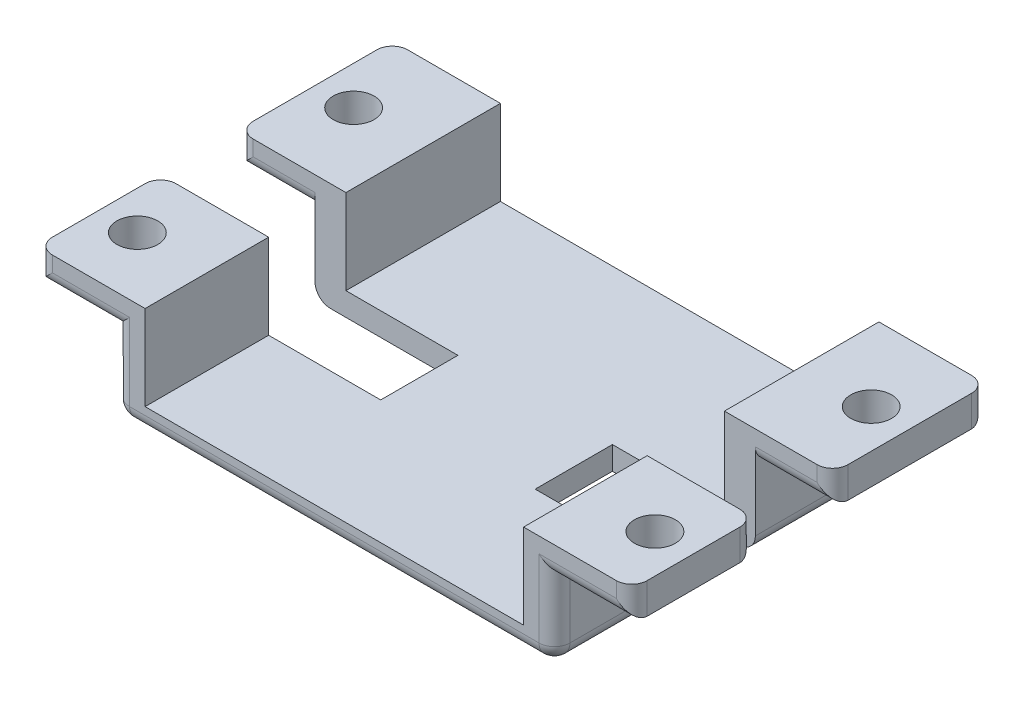
from build123d import *

# Parameters (mm, degrees)
SKETCH1_W           = 28.5
SKETCH1_H           = 36
SKETCH1_W_2         = 24.5
SKETCH1_H_2         = 33
BOSS_EXTRUDE1_DEPTH = 10
SKETCH2_W           = 5
SKETCH2_H           = 4
BOSS_EXTRUDE2_DEPTH = 10
SKETCH3_R           = 1.325
CUT_EXTRUDE1_DEPTH  = 10
FILLET1_R           = 1
FILLET2_R           = 1
CUT_EXTRUDE2_DEPTH  = 40.322385482
SKETCH5_W           = 15
SKETCH5_H           = 1.5
SKETCH5_W_2         = 2
SKETCH5_H_2         = 10
BOSS_EXTRUDE3_DEPTH = 5
SKETCH6_W           = 10
SKETCH6_H           = 1.5
BOSS_EXTRUDE4_DEPTH = 5
BOSS_EXTRUDE5_DEPTH = 8
SKETCH8_W           = 7
SKETCH8_H           = 3
CUT_EXTRUDE3_DEPTH  = 5
SKETCH9_W           = 5
SKETCH9_H           = 2.1
CUT_EXTRUDE4_DEPTH  = 5
SKETCH10_W          = 10
SKETCH10_H          = 1.5
BOSS_EXTRUDE6_DEPTH = 8
SKETCH11_W          = 5
SKETCH11_H          = 4
BOSS_EXTRUDE7_DEPTH = 8
SKETCH12_R          = 1.325
CUT_EXTRUDE5_DEPTH  = 42.37405588
CUT_EXTRUDE6_DEPTH  = 46.072164359
FILLET3_R           = 1


with BuildPart() as part:
    # Sketch1 → Boss-Extrude1 (new body)
    with BuildSketch(Plane.XY):
        Rectangle(SKETCH1_W, SKETCH1_H)
        Rectangle(SKETCH1_W_2, SKETCH1_H_2, mode=Mode.SUBTRACT)
    extrude(amount=BOSS_EXTRUDE1_DEPTH)

    # Sketch2 → Boss-Extrude2 (add)
    with BuildSketch(Plane.XY.offset(10)):
        with Locations((-16.75, -11)):
            Rectangle(SKETCH2_W, SKETCH2_H)
        with Locations((16.75, -11)):
            Rectangle(SKETCH2_W, SKETCH2_H)
    extrude(amount=-BOSS_EXTRUDE2_DEPTH)

    # Sketch3 → Cut-Extrude1 (cut)
    with BuildSketch(Plane(origin=(0, -9, 0), x_dir=(1, 0, 0), z_dir=(0, 1, 0))):
        with Locations(Location((-16.75, -5, 0), (0, 0, 270))):
            Circle(SKETCH3_R)
        with Locations(Location((16.75, -5, 0), (0, 0, 270))):
            Circle(SKETCH3_R)
    extrude(amount=-CUT_EXTRUDE1_DEPTH, mode=Mode.SUBTRACT)


with BuildPart() as body_2:
    # Split1: the piece on the far side of the plane
    add(part.part)
    split(bisect_by=Plane(origin=(0, -11, 0), x_dir=(0, 0, -1), z_dir=(0, -1, 0)), keep=Keep.BOTTOM)

    # Fillet1
    fillet1_edges = [body_2.edges().sort_by_distance(p)[0] for p in [
        (-16.75, -9, 10),
        (-19.25, -10, 10),
        (-19.25, -10, 0),
        (-16.75, -9, 0),
        (14.25, 4.5, 0),
        (0, 18, 0),
        (-14.25, 4.5, 0),
        (16.75, -9, 0),
        (19.25, -10, 10),
        (19.25, -10, 0),
        (16.75, -9, 10),
    ]]
    fillet(fillet1_edges, radius=FILLET1_R)

    # Sketch4 → Cut-Extrude2 (cut, through all)
    with BuildSketch(Plane.ZY.offset(14.25)):
        with BuildLine():
            Line((7, 12.5), (7, -3.5))
            ThreePointArc((7, -3.5), (5, -5.5), (3, -3.5))
            Line((3, -3.5), (3, 12.5))
            ThreePointArc((3, 12.5), (5, 14.5), (7, 12.5))
        make_face()
    extrude(amount=-CUT_EXTRUDE2_DEPTH, mode=Mode.SUBTRACT)

    # Sketch5 → Boss-Extrude3 (add)
    with BuildSketch(Plane.XY.offset(10)):
        with Locations((0, 17.25)):
            Rectangle(SKETCH5_W, SKETCH5_H)
        with Locations((-13.25, 4)):
            Rectangle(SKETCH5_W_2, SKETCH5_H_2)
        with Locations((13.25, 4)):
            Rectangle(SKETCH5_W_2, SKETCH5_H_2)
    extrude(amount=BOSS_EXTRUDE3_DEPTH)



with BuildPart() as part_1:
    add(part.part)

    # Split1
    split(bisect_by=Plane(origin=(0, -11, 0), x_dir=(0, 0, -1), z_dir=(0, -1, 0)), keep=Keep.TOP)

    # Fillet2
    fillet2_edges = [part_1.edges().sort_by_distance(p)[0] for p in [
        (-14.25, -15.5, 0),
        (-16.75, -13, 0),
        (-19.25, -12, 10),
        (-16.75, -13, 10),
        (-19.25, -12, 0),
        (16.75, -13, 10),
        (19.25, -12, 10),
        (19.25, -12, 0),
        (16.75, -13, 0),
        (0, -18, 0),
        (14.25, -15.5, 0),
    ]]
    fillet(fillet2_edges, radius=FILLET2_R)

    # Sketch6 → Boss-Extrude4 (add)
    with BuildSketch(Plane.XY.offset(10)):
        with Locations((0, -17.25)):
            Rectangle(SKETCH6_W, SKETCH6_H)
    extrude(amount=BOSS_EXTRUDE4_DEPTH)


with BuildPart() as body_2_1:
    add(body_2.part)

    add(part_1.part)  # Boss-Extrude5 merges part
    # Sketch7 → Boss-Extrude5 (add)
    with BuildSketch(Plane.XY.offset(15)):
        Polygon((14.25, 9), (14.25, 18), (14.25, 19.5), (-14.25, 19.5), (-14.25, 18), (-14.25, 9), (-14.25, -1), (-14.25, -10), (-14.25, -11), (-12.25, -11), (-12.25, -1), (-12.25, 9), (-12.25, 16.5), (-7.5, 16.5), (7.5, 16.5), (12.25, 16.5), (12.25, 9), (12.25, -1), (12.25, -11), (14.25, -11), (14.25, -10), (14.25, -1), align=None)
    extrude(amount=BOSS_EXTRUDE5_DEPTH)

    # Sketch8 → Cut-Extrude3 (cut)
    with BuildSketch(Plane.XY.offset(23)):
        with Locations((0, 16.5)):
            Rectangle(SKETCH8_W, SKETCH8_H)
    extrude(amount=-CUT_EXTRUDE3_DEPTH, mode=Mode.SUBTRACT)

    # Sketch9 → Cut-Extrude4 (cut)
    with BuildSketch(Plane.XY.offset(23)):
        with Locations((6, 17.55)):
            Rectangle(SKETCH9_W, SKETCH9_H)
        with Locations((-6, 17.55)):
            Rectangle(SKETCH9_W, SKETCH9_H)
    extrude(amount=-CUT_EXTRUDE4_DEPTH, mode=Mode.SUBTRACT)

    # Sketch10 → Boss-Extrude6 (add)
    with BuildSketch(Plane.XY.offset(15)):
        Polygon((-5, -18), (-5, -16.5), (-12.25, -16.5), (-12.25, -11), (-14.25, -11), (-14.25, -12), (-14.25, -18), align=None)
        with Locations((0, -17.25)):
            Rectangle(SKETCH10_W, SKETCH10_H)
        Polygon((12.25, -11), (12.25, -16.5), (5, -16.5), (5, -18), (14.25, -18), (14.25, -12), (14.25, -11), align=None)
    extrude(amount=BOSS_EXTRUDE6_DEPTH)

    # Sketch11 → Boss-Extrude7 (add)
    with BuildSketch(Plane.XY.offset(23)):
        with Locations((-16.75, -11)):
            Rectangle(SKETCH11_W, SKETCH11_H)
        with Locations((16.75, -11)):
            Rectangle(SKETCH11_W, SKETCH11_H)
    extrude(amount=-BOSS_EXTRUDE7_DEPTH)

    # Sketch12 → Cut-Extrude5 (cut, through all)
    with BuildSketch(Plane(origin=(0, -9, 0), x_dir=(1, 0, 0), z_dir=(0, 1, 0))):
        with Locations(Location((-16.75, -19, 0), (0, 0, 270))):
            Circle(SKETCH12_R)
        with Locations(Location((16.75, -19, 0), (0, 0, 270))):
            Circle(SKETCH12_R)
    extrude(amount=-CUT_EXTRUDE5_DEPTH, mode=Mode.SUBTRACT)

    # Sketch13 → Cut-Extrude6 (cut, through all)
    with BuildSketch(Plane.ZY.offset(14.25)):
        with BuildLine():
            Line((17, -3.5), (17, 12.5))
            ThreePointArc((17, 12.5), (19, 14.5), (21, 12.5))
            Line((21, 12.5), (21, -3.5))
            ThreePointArc((21, -3.5), (19, -5.5), (17, -3.5))
        make_face()
    extrude(amount=-CUT_EXTRUDE6_DEPTH, mode=Mode.SUBTRACT)

    # Fillet3
    # the kernel refuses this fillet: 1 mm, written as the material it takes off along each edge
    with BuildSketch(Plane(origin=(13.25, -17, 1), x_dir=(1, 0, 0), z_dir=(0, -1, 0))) as fillet3_piece_1_section:
        Polygon((0, 0), (FILLET3_R, 0), (FILLET3_R, -FILLET3_R), (0, -FILLET3_R), align=None)
    fillet3_piece_1 = extrude(amount=FILLET3_R, mode=Mode.PRIVATE)
    fillet3_piece_1 = fillet3_piece_1 - Plane(origin=(13.25, -17, 1), x_dir=(-0.7071067811865475, 0, 0.7071067811865475), z_dir=(0, -1, 0)) * Sphere(FILLET3_R, mode=Mode.PRIVATE)
    add(fillet3_piece_1, mode=Mode.SUBTRACT)
    with BuildSketch(Plane(origin=(-13.25, -17, 1), x_dir=(-1, 0, 0), z_dir=(0, -1, 0))) as fillet3_piece_2_section:
        Polygon((0, 0), (FILLET3_R, 0), (FILLET3_R, FILLET3_R), (0, FILLET3_R), align=None)
    fillet3_piece_2 = extrude(amount=FILLET3_R, mode=Mode.PRIVATE)
    fillet3_piece_2 = fillet3_piece_2 - Plane(origin=(-13.25, -17, 1), x_dir=(0.7071067811865475, 0, 0.7071067811865475), z_dir=(0, -1, 0)) * Sphere(FILLET3_R, mode=Mode.PRIVATE)
    add(fillet3_piece_2, mode=Mode.SUBTRACT)
    with BuildSketch(Plane(origin=(13.25, 17, 1), x_dir=(0, 1, 0), z_dir=(1, 0, 0))) as fillet3_piece_3_section:
        Polygon((0, 0), (FILLET3_R, 0), (FILLET3_R, -FILLET3_R), (0, -FILLET3_R), align=None)
    fillet3_piece_3 = extrude(amount=FILLET3_R, mode=Mode.PRIVATE)
    fillet3_piece_3 = fillet3_piece_3 - Plane(origin=(13.25, 17, 1), x_dir=(0, -0.7071067811865475, 0.7071067811865475), z_dir=(1, 0, 0)) * Sphere(FILLET3_R, mode=Mode.PRIVATE)
    add(fillet3_piece_3, mode=Mode.SUBTRACT)
    with BuildSketch(Plane(origin=(-13.25, 17, 1), x_dir=(0, 1, 0), z_dir=(-1, 0, 0))) as fillet3_piece_4_section:
        Polygon((0, 0), (FILLET3_R, 0), (FILLET3_R, FILLET3_R), (0, FILLET3_R), align=None)
    fillet3_piece_4 = extrude(amount=FILLET3_R, mode=Mode.PRIVATE)
    fillet3_piece_4 = fillet3_piece_4 - Plane(origin=(-13.25, 17, 1), x_dir=(0, -0.7071067811865475, 0.7071067811865475), z_dir=(-1, 0, 0)) * Sphere(FILLET3_R, mode=Mode.PRIVATE)
    add(fillet3_piece_4, mode=Mode.SUBTRACT)
    with BuildSketch(Plane(origin=(13.25, -17, 22), x_dir=(0, 0, 1), z_dir=(0, -1, 0))) as fillet3_piece_5_section:
        Polygon((0, 0), (FILLET3_R, 0), (FILLET3_R, -FILLET3_R), (0, -FILLET3_R), align=None)
    fillet3_piece_5 = extrude(amount=FILLET3_R, mode=Mode.PRIVATE)
    fillet3_piece_5 = fillet3_piece_5 - Plane(origin=(13.25, -17, 22), x_dir=(-0.7071067811865475, 0, -0.7071067811865475), z_dir=(0, -1, 0)) * Sphere(FILLET3_R, mode=Mode.PRIVATE)
    add(fillet3_piece_5, mode=Mode.SUBTRACT)
    with BuildSketch(Plane(origin=(-13.25, -17, 22), x_dir=(-1, 0, 0), z_dir=(0, -1, 0))) as fillet3_piece_6_section:
        Polygon((0, 0), (FILLET3_R, 0), (FILLET3_R, -FILLET3_R), (0, -FILLET3_R), align=None)
    fillet3_piece_6 = extrude(amount=FILLET3_R, mode=Mode.PRIVATE)
    fillet3_piece_6 = fillet3_piece_6 - Plane(origin=(-13.25, -17, 22), x_dir=(0.7071067811865475, 0, -0.7071067811865475), z_dir=(0, -1, 0)) * Sphere(FILLET3_R, mode=Mode.PRIVATE)
    add(fillet3_piece_6, mode=Mode.SUBTRACT)
    with BuildSketch(Plane(origin=(-14.25, 18, 1), x_dir=(0, -1, 0), z_dir=(0, 0, 1)), Plane(origin=(-14.25, -18, 1), x_dir=(1, 0, 0), z_dir=(0, 0, 1))) as fillet3_piece_7:
        with BuildLine():
            CenterArc((FILLET3_R, FILLET3_R), FILLET3_R, 180, 90)
            Line((0, FILLET3_R), (0, 0))
            Line((0, 0), (FILLET3_R, 0))
        make_face()
    extrude(amount=11.5, mode=Mode.SUBTRACT)
    with BuildSketch(Plane(origin=(14.25, 18, 1), x_dir=(0, -1, 0), z_dir=(0, 0, 1)), Plane(origin=(14.25, -18, 1), x_dir=(-1, 0, 0), z_dir=(0, 0, 1))) as fillet3_piece_8:
        with BuildLine():
            CenterArc((FILLET3_R, -FILLET3_R), FILLET3_R, 90, 90)
            Line((0, -FILLET3_R), (0, 0))
            Line((0, 0), (FILLET3_R, 0))
        make_face()
    extrude(amount=11.5, mode=Mode.SUBTRACT)
    with BuildSketch(Plane(origin=(14.25, 19.5, 12.5), x_dir=(0, -1, 0), z_dir=(0, 0, 1))) as fillet3_piece_9:
        with BuildLine():
            CenterArc((FILLET3_R, -FILLET3_R), FILLET3_R, 90, 90)
            Line((0, -FILLET3_R), (0, 0))
            Line((0, 0), (FILLET3_R, 0))
        make_face()
    extrude(amount=13, mode=Mode.SUBTRACT)
    with BuildSketch(Plane(origin=(-14.25, 19.5, 12.5), x_dir=(0, -1, 0), z_dir=(0, 0, 1))) as fillet3_piece_10:
        with BuildLine():
            CenterArc((FILLET3_R, FILLET3_R), FILLET3_R, 180, 90)
            Line((0, FILLET3_R), (0, 0))
            Line((0, 0), (FILLET3_R, 0))
        make_face()
    extrude(amount=13, mode=Mode.SUBTRACT)
    with BuildSketch(Plane(origin=(14.25, -17, 23), x_dir=(-1, 0, 0), z_dir=(0, 1, 0)), Plane(origin=(-14.25, -17, 23), x_dir=(0, 0, -1), z_dir=(0, 1, 0))) as fillet3_piece_11:
        with BuildLine():
            CenterArc((FILLET3_R, -FILLET3_R), FILLET3_R, 90, 90)
            Line((0, -FILLET3_R), (0, 0))
            Line((0, 0), (FILLET3_R, 0))
        make_face()
    extrude(amount=4, mode=Mode.SUBTRACT)
    with BuildSketch(Plane(origin=(-14.25, -9, 23), x_dir=(1, 0, 0), z_dir=(0, 1, 0))) as fillet3_piece_12:
        with BuildLine():
            CenterArc((FILLET3_R, FILLET3_R), FILLET3_R, 180, 90)
            Line((0, FILLET3_R), (0, 0))
            Line((0, 0), (FILLET3_R, 0))
        make_face()
    extrude(amount=31, mode=Mode.SUBTRACT)
    with BuildSketch(Plane(origin=(-13.25, -18, 23), x_dir=(0, 0, -1), z_dir=(1, 0, 0))) as fillet3_piece_13:
        with BuildLine():
            CenterArc((FILLET3_R, FILLET3_R), FILLET3_R, 180, 90)
            Line((0, FILLET3_R), (0, 0))
            Line((0, 0), (FILLET3_R, 0))
        make_face()
    extrude(amount=26.5, mode=Mode.SUBTRACT)
    with BuildSketch(Plane(origin=(-14.25, -18, 12.5), x_dir=(1, 0, 0), z_dir=(0, 0, 1))) as fillet3_piece_14:
        with BuildLine():
            CenterArc((FILLET3_R, FILLET3_R), FILLET3_R, 180, 90)
            Line((0, FILLET3_R), (0, 0))
            Line((0, 0), (FILLET3_R, 0))
        make_face()
    extrude(amount=9.5, mode=Mode.SUBTRACT)
    with BuildSketch(Plane(origin=(14.25, -18, 12.5), x_dir=(-1, 0, 0), z_dir=(0, 0, 1))) as fillet3_piece_15:
        with BuildLine():
            CenterArc((FILLET3_R, -FILLET3_R), FILLET3_R, 90, 90)
            Line((0, -FILLET3_R), (0, 0))
            Line((0, 0), (FILLET3_R, 0))
        make_face()
    extrude(amount=9.5, mode=Mode.SUBTRACT)
    with BuildSketch(Plane(origin=(-21.75, -9, 23), x_dir=(0, -1, 0), z_dir=(1, 0, 0)), Plane(origin=(-14.25, -13, 23), x_dir=(0, 1, 0), z_dir=(-1, 0, 0)), Plane(origin=(14.25, -9, 23), x_dir=(0, -1, 0), z_dir=(1, 0, 0)), Plane(origin=(21.75, -13, 23), x_dir=(0, 1, 0), z_dir=(-1, 0, 0))) as fillet3_piece_16:
        with BuildLine():
            CenterArc((FILLET3_R, FILLET3_R), FILLET3_R, 180, 90)
            Line((0, FILLET3_R), (0, 0))
            Line((0, 0), (FILLET3_R, 0))
        make_face()
    extrude(amount=7.5, mode=Mode.SUBTRACT)
    with BuildSketch(Plane(origin=(-19.25, -15.5, 23), x_dir=(1, 0, 0), z_dir=(0, 1, 0)), Plane(origin=(19.25, -6.5, 23), x_dir=(-1, 0, 0), z_dir=(0, -1, 0))) as fillet3_piece_17:
        with BuildLine():
            CenterArc((FILLET3_R, FILLET3_R), FILLET3_R, 180, 90)
            Line((0, FILLET3_R), (0, 0))
            Line((0, 0), (FILLET3_R, 0))
        make_face()
    extrude(amount=9, mode=Mode.SUBTRACT)
    with BuildSketch(Plane(origin=(-21.75, -9, 15), x_dir=(0, -1, 0), z_dir=(1, 0, 0)), Plane(origin=(-14.25, -13, 15), x_dir=(0, 1, 0), z_dir=(-1, 0, 0)), Plane(origin=(14.25, -9, 15), x_dir=(0, -1, 0), z_dir=(1, 0, 0)), Plane(origin=(21.75, -13, 15), x_dir=(0, 1, 0), z_dir=(-1, 0, 0))) as fillet3_piece_18:
        with BuildLine():
            CenterArc((FILLET3_R, -FILLET3_R), FILLET3_R, 90, 90)
            Line((0, -FILLET3_R), (0, 0))
            Line((0, 0), (FILLET3_R, 0))
        make_face()
    extrude(amount=7.5, mode=Mode.SUBTRACT)
    with BuildSketch(Plane(origin=(-19.25, -15.5, 15), x_dir=(1, 0, 0), z_dir=(0, 1, 0)), Plane(origin=(19.25, -6.5, 15), x_dir=(-1, 0, 0), z_dir=(0, -1, 0))) as fillet3_piece_19:
        with BuildLine():
            CenterArc((FILLET3_R, -FILLET3_R), FILLET3_R, 90, 90)
            Line((0, -FILLET3_R), (0, 0))
            Line((0, 0), (FILLET3_R, 0))
        make_face()
    extrude(amount=9, mode=Mode.SUBTRACT)
    with BuildSketch(Plane(origin=(14.25, -9, 23), x_dir=(-1, 0, 0), z_dir=(0, 1, 0))) as fillet3_piece_20:
        with BuildLine():
            CenterArc((FILLET3_R, -FILLET3_R), FILLET3_R, 90, 90)
            Line((0, -FILLET3_R), (0, 0))
            Line((0, 0), (FILLET3_R, 0))
        make_face()
    extrude(amount=31, mode=Mode.SUBTRACT)
    with BuildSketch(Plane(origin=(14.25, -17, 23), x_dir=(-1, 0, 0), z_dir=(0, 1, 0))) as fillet3_piece_21a_section:
        with BuildLine():
            CenterArc((FILLET3_R, -FILLET3_R), FILLET3_R, 90, 90)
            Line((0, -FILLET3_R), (0, 0))
            Line((0, 0), (FILLET3_R, 0))
        make_face()
    fillet3_piece_21a = extrude(amount=6.5, mode=Mode.PRIVATE)
    fillet3_piece_21a = split(fillet3_piece_21a, bisect_by=Plane(origin=(14.023604886, -13, 22.773604886), z_dir=(0, 1, 0)), keep=Keep.TOP, mode=Mode.PRIVATE)
    with BuildSketch(Plane(origin=(21.75, -13, 23), x_dir=(0, 1, 0), z_dir=(-1, 0, 0))) as fillet3_piece_21b_section:
        with BuildLine():
            CenterArc((FILLET3_R, FILLET3_R), FILLET3_R, 180, 90)
            Line((0, FILLET3_R), (0, 0))
            Line((0, 0), (FILLET3_R, 0))
        make_face()
    fillet3_piece_21b = extrude(amount=10, mode=Mode.PRIVATE)
    fillet3_piece_21b = split(fillet3_piece_21b, bisect_by=Plane(origin=(14.25, -12.773604886, 22.773604886), z_dir=(-1, 0, 0)), keep=Keep.TOP, mode=Mode.PRIVATE)
    fillet3_piece_21 = fillet3_piece_21a & fillet3_piece_21b
    add(fillet3_piece_21, mode=Mode.SUBTRACT)
    with BuildSketch(Plane(origin=(-14.25, -11.5, 23), x_dir=(1, 0, 0), z_dir=(0, 1, 0))) as fillet3_piece_22a_section:
        with BuildLine():
            CenterArc((FILLET3_R, FILLET3_R), FILLET3_R, 180, 90)
            Line((0, FILLET3_R), (0, 0))
            Line((0, 0), (FILLET3_R, 0))
        make_face()
    fillet3_piece_22a = extrude(amount=33.5, mode=Mode.PRIVATE)
    fillet3_piece_22a = split(fillet3_piece_22a, bisect_by=Plane(origin=(-14.023604886, -9, 22.773604886), z_dir=(0, -1, 0)), keep=Keep.TOP, mode=Mode.PRIVATE)
    with BuildSketch(Plane(origin=(-21.75, -9, 23), x_dir=(0, -1, 0), z_dir=(1, 0, 0))) as fillet3_piece_22b_section:
        with BuildLine():
            CenterArc((FILLET3_R, FILLET3_R), FILLET3_R, 180, 90)
            Line((0, FILLET3_R), (0, 0))
            Line((0, 0), (FILLET3_R, 0))
        make_face()
    fillet3_piece_22b = extrude(amount=10, mode=Mode.PRIVATE)
    fillet3_piece_22b = split(fillet3_piece_22b, bisect_by=Plane(origin=(-14.25, -9.226395114, 22.773604886), z_dir=(1, 0, 0)), keep=Keep.TOP, mode=Mode.PRIVATE)
    fillet3_piece_22 = fillet3_piece_22a & fillet3_piece_22b
    add(fillet3_piece_22, mode=Mode.SUBTRACT)
    with BuildSketch(Plane(origin=(-14.25, -17, 23), x_dir=(0, 0, -1), z_dir=(0, 1, 0))) as fillet3_piece_23a_section:
        with BuildLine():
            CenterArc((FILLET3_R, -FILLET3_R), FILLET3_R, 90, 90)
            Line((0, -FILLET3_R), (0, 0))
            Line((0, 0), (FILLET3_R, 0))
        make_face()
    fillet3_piece_23a = extrude(amount=6.5, mode=Mode.PRIVATE)
    fillet3_piece_23a = split(fillet3_piece_23a, bisect_by=Plane(origin=(-14.023604886, -13, 22.773604886), z_dir=(0, 1, 0)), keep=Keep.TOP, mode=Mode.PRIVATE)
    with BuildSketch(Plane(origin=(-11.75, -13, 23), x_dir=(0, 1, 0), z_dir=(-1, 0, 0))) as fillet3_piece_23b_section:
        with BuildLine():
            CenterArc((FILLET3_R, FILLET3_R), FILLET3_R, 180, 90)
            Line((0, FILLET3_R), (0, 0))
            Line((0, 0), (FILLET3_R, 0))
        make_face()
    fillet3_piece_23b = extrude(amount=10, mode=Mode.PRIVATE)
    fillet3_piece_23b = split(fillet3_piece_23b, bisect_by=Plane(origin=(-14.25, -12.773604886, 22.773604886), z_dir=(1, 0, 0)), keep=Keep.TOP, mode=Mode.PRIVATE)
    fillet3_piece_23 = fillet3_piece_23a & fillet3_piece_23b
    add(fillet3_piece_23, mode=Mode.SUBTRACT)
    with BuildSketch(Plane(origin=(11.75, -9, 23), x_dir=(0, -1, 0), z_dir=(1, 0, 0))) as fillet3_piece_24a_section:
        with BuildLine():
            CenterArc((FILLET3_R, FILLET3_R), FILLET3_R, 180, 90)
            Line((0, FILLET3_R), (0, 0))
            Line((0, 0), (FILLET3_R, 0))
        make_face()
    fillet3_piece_24a = extrude(amount=10, mode=Mode.PRIVATE)
    fillet3_piece_24a = split(fillet3_piece_24a, bisect_by=Plane(origin=(14.25, -9.226395114, 22.773604886), z_dir=(-1, 0, 0)), keep=Keep.TOP, mode=Mode.PRIVATE)
    with BuildSketch(Plane(origin=(14.25, -11.5, 23), x_dir=(-1, 0, 0), z_dir=(0, 1, 0))) as fillet3_piece_24b_section:
        with BuildLine():
            CenterArc((FILLET3_R, -FILLET3_R), FILLET3_R, 90, 90)
            Line((0, -FILLET3_R), (0, 0))
            Line((0, 0), (FILLET3_R, 0))
        make_face()
    fillet3_piece_24b = extrude(amount=33.5, mode=Mode.PRIVATE)
    fillet3_piece_24b = split(fillet3_piece_24b, bisect_by=Plane(origin=(14.023604886, -9, 22.773604886), z_dir=(0, -1, 0)), keep=Keep.TOP, mode=Mode.PRIVATE)
    fillet3_piece_24 = fillet3_piece_24a & fillet3_piece_24b
    add(fillet3_piece_24, mode=Mode.SUBTRACT)


with BuildPart() as body_2_2:
    # Split2: the piece on the far side of the plane
    add(body_2_1.part)
    split(bisect_by=Plane(origin=(0, -11, 0), x_dir=(0, 0, -1), z_dir=(0, -1, 0)), keep=Keep.BOTTOM)


with BuildPart() as body_2_3:
    add(body_2_1.part)

    # Split2
    split(bisect_by=Plane(origin=(0, -11, 0), x_dir=(0, 0, -1), z_dir=(0, -1, 0)), keep=Keep.TOP)


solid = body_2_3.part
